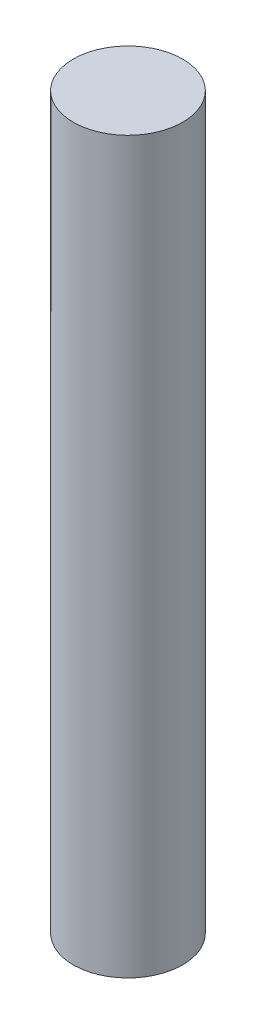
from build123d import *

# Parameters (mm, degrees)
SKETCH1_W = 9.525
SKETCH1_H = 127


with BuildPart() as part:
    # Sketch1 → Revolve1 (revolve)
    with BuildSketch(Plane.XY):
        with Locations((4.7625, 0)):
            Rectangle(SKETCH1_W, SKETCH1_H)
    revolve(axis=Axis((0, 101.6, 0), (0, -1, 0)))


solid = part.part
